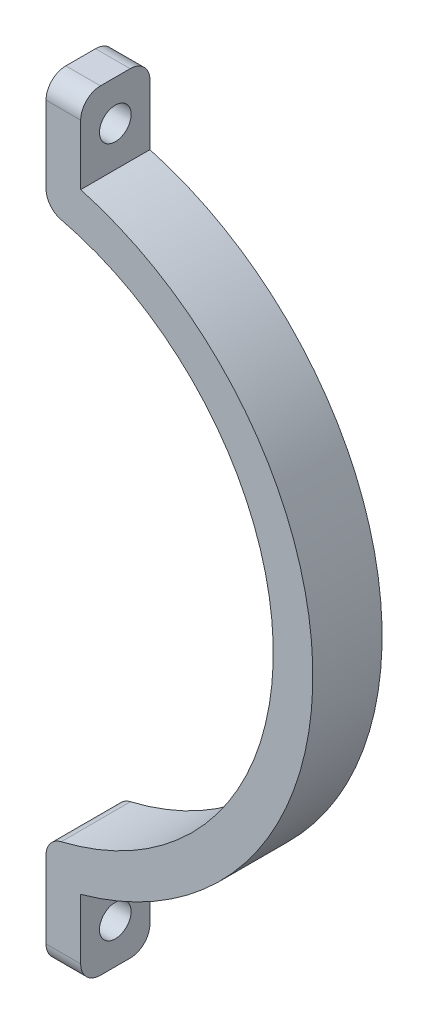
from build123d import *

# Parameters (mm, degrees)
EXTRUDE_1_DEPTH      = 3
SKETCH_7_R           = 2.2499999999999996
SKETCH_7_R_2         = 2.249999999999999
CUT_EXTRUDE_2_DEPTH  = 143.9554309486725
SKETCH_8_R           = 8
CUT_EXTRUDE_3_DEPTH  = 143.9554309486725
CUT_EXTRUDE_4_DEPTH  = 3
CUT_EXTRUDE_5_DEPTH  = 3
CUT_EXTRUDE_8_DEPTH  = 3
SKETCH_12_R          = 1.6999999999999977
SKETCH_12_R_2        = 1.6999999999999975
SKETCH_12_R_3        = 1.7000000000000015
SKETCH_12_R_4        = 1.7000000000000024
CUT_EXTRUDE_9_DEPTH  = 3
SKETCH_13_R          = 1.6999999999999977
SKETCH_13_R_2        = 1.7000000000000015
SKETCH_13_R_3        = 1.6999999999999973
CUT_EXTRUDE_11_DEPTH = 3
CUT_EXTRUDE_12_DEPTH = 143.9554309486725
FILLET_1_R           = 2
FILLET_2_R           = 2
CUT_EXTRUDE_13_DEPTH = 143.9554309486725
CUT_EXTRUDE_14_DEPTH = 143.9554309486725
CUT_EXTRUDE_15_DEPTH = 143.9554309486725
CUT_EXTRUDE_16_DEPTH = 143.9554309486725
EXTRUDE_2_DEPTH      = 4
SKETCH_20_W          = 4
SKETCH_20_H          = 23
EXTRUDE_3_DEPTH      = 5
EXTRUDE_4_DEPTH      = 7
EXTRUDE_5_DEPTH      = 9
CUT_EXTRUDE_17_DEPTH = 5
EXTRUDE_6_DEPTH      = 5
EXTRUDE_7_DEPTH      = 7
SKETCH_26_R          = 1.6000000000000008
SKETCH_26_R_2        = 1.5999999999999974
SKETCH_26_R_3        = 1.5999999999999908
SKETCH_26_R_4        = 1.5999999999999979
CUT_EXTRUDE_18_DEPTH = 27.000000000000004
FILLET_3_R           = 2
FILLET_4_R           = 2
FILLET_5_R           = 2
FILLET_6_R           = 2
FILLET_7_R           = 2
FILLET_8_R           = 2
FILLET_9_R           = 2
FILLET_10_R          = 2
FILLET_11_R          = 2
FILLET_12_R          = 2
SKETCH_29_W          = 19.839717489785563
SKETCH_29_H          = 23.000000000000004
EXTRUDE_8_DEPTH      = 4
CUT_EXTRUDE_21_DEPTH = 10
FILLET_13_R          = 3
EXTRUDE_START        = -24
EXTRUDE_9_DEPTH      = 24
CUT_EXTRUDE_22_DEPTH = 10
FILLET_14_R          = 3
EXTRUDE_10_DEPTH     = 4
SKETCH_42_W          = 21.709593228890974
SKETCH_42_H          = 23.000000000000007
EXTRUDE_11_DEPTH     = 4
CUT_EXTRUDE_23_DEPTH = 10
FILLET_15_R          = 3
SKETCH_44_W          = 80.94590288648357
SKETCH_44_H          = 89.37149872597075
CUT_EXTRUDE_24_DEPTH = 30
SKETCH_45_W          = 13.184397867353104
SKETCH_45_H          = 88.75583781718359
CUT_EXTRUDE_25_DEPTH = 40


# Read off the part's stored shape, not the designer's step: 切除-拉伸19
with BuildPart() as part:
    # 草图1 → 凸台-拉伸1 (new body)
    # profile 1 of 14: a face of its own
    with BuildSketch(Plane.XY):
        with BuildLine():
            Line((59.99999999999994, 106.6032960019551), (35.88916363361177, 121.66451915871228))
            Line((35.88916363361177, 121.66451915871228), (-35.88916363361177, 121.66451915871227))
            Line((-35.88916363361177, 121.66451915871227), (-59.99999999999998, 106.60329600195507))
            Line((-59.99999999999998, 106.60329600195509), (-59.99999999999998, 94.80189226525114))
            Line((-59.999999999999964, 94.80189226525113), (-44.999999999999964, 94.80189226525111))
            ThreePointArc((-44.999999999999964, 94.80189226525111), (-43.7625631329235, 94.28932913232757), (-43.24999999999996, 93.05189226525111))
            Line((-43.24999999999996, 93.05189226525111), (-37.74999999999997, 93.05189226525111))
            ThreePointArc((-37.74999999999997, 93.05189226525111), (-37.237436867076426, 94.28932913232757), (-35.999999999999964, 94.80189226525111))
            Line((-35.999999999999964, 94.80189226525111), (-20.999999999999964, 94.80189226525111))
            ThreePointArc((-20.999999999999964, 94.80189226525111), (-19.762563132923507, 94.28932913232757), (-19.249999999999964, 93.05189226525111))
            Line((-19.249999999999957, 93.05189226525111), (19.249999999999986, 93.05189226525111))
            ThreePointArc((19.24999999999998, 93.05189226525111), (19.76256313292352, 94.28932913232757), (20.99999999999998, 94.80189226525111))
            Line((20.99999999999998, 94.80189226525111), (35.99999999999998, 94.80189226525111))
            ThreePointArc((35.99999999999998, 94.80189226525111), (37.23743686707644, 94.28932913232757), (37.749999999999986, 93.05189226525111))
            Line((37.749999999999986, 93.05189226525111), (43.249999999999986, 93.05189226525111))
            ThreePointArc((43.24999999999997, 93.05189226525111), (43.76256313292352, 94.28932913232757), (44.99999999999998, 94.80189226525111))
            Line((44.99999999999998, 94.80189226525111), (59.99999999999997, 94.80189226525113))
            Line((59.99999999999997, 94.80189226525113), (59.99999999999997, 106.6032960019551))
        make_face()
    # profile 2 of 14: a face of its own
    with BuildSketch(Plane.XY):
        with BuildLine():
            Line((66.90169409482209, 102.29204137178812), (59.99999999999994, 106.6032960019551))
            Line((59.99999999999997, 106.6032960019551), (59.99999999999997, 94.80189226525113))
            ThreePointArc((59.99999999999997, 94.80189226525113), (61.23743686707643, 94.28932913232758), (61.74999999999998, 93.05189226525113))
            Line((61.749999999999986, 93.05189226525111), (66.9016940948221, 93.05189226525111))
            Line((66.90169409482209, 93.05189226525111), (66.90169409482209, 102.29204137178812))
        make_face()
    # profile 3 of 14: a face of its own
    with BuildSketch(Plane.XY):
        with BuildLine():
            Line((-59.99999999999998, 94.80189226525114), (-59.99999999999998, 106.60329600195509))
            Line((-59.99999999999998, 106.60329600195507), (-66.90169409482209, 102.2920413717881))
            Line((-66.90169409482209, 102.2920413717881), (-66.90169409482209, 93.05189226525111))
            Line((-66.90169409482209, 93.05189226525111), (-61.74999999999997, 93.05189226525111))
            ThreePointArc((-61.74999999999997, 93.05189226525113), (-61.237436867076426, 94.28932913232758), (-59.999999999999964, 94.80189226525113))
        make_face()
    # profile 4 of 14: a face of its own
    with BuildSketch(Plane.XY):
        with BuildLine():
            Line((66.90169409482212, 63.05189226525111), (66.90169409482209, 93.05189226525111))
            Line((66.9016940948221, 93.05189226525111), (61.749999999999986, 93.05189226525111))
            ThreePointArc((61.74999999999998, 93.05189226525113), (61.23743686707643, 91.81445539817466), (59.99999999999997, 91.30189226525113))
            Line((59.99999999999998, 91.30189226525113), (59.99999999999998, 64.80189226525113))
            ThreePointArc((59.99999999999998, 64.8018922652511), (61.23743686707643, 64.28932913232755), (61.74999999999997, 63.0518922652511))
            Line((61.749999999999986, 63.05189226525111), (66.9016940948221, 63.05189226525111))
        make_face()
    # profile 5 of 14: a face of its own
    with BuildSketch(Plane.XY):
        with BuildLine():
            Line((-61.74999999999997, 93.05189226525111), (-66.90169409482209, 93.05189226525111))
            Line((-66.90169409482209, 93.05189226525111), (-66.90169409482209, 63.05189226525111))
            Line((-66.90169409482209, 63.05189226525111), (-61.74999999999997, 63.05189226525111))
            ThreePointArc((-61.74999999999997, 63.0518922652511), (-61.237436867076426, 64.28932913232755), (-59.999999999999964, 64.8018922652511))
            Line((-59.99999999999999, 64.8018922652511), (-59.99999999999998, 91.30189226525114))
            ThreePointArc((-59.999999999999964, 91.30189226525113), (-61.237436867076426, 91.81445539817467), (-61.74999999999997, 93.05189226525113))
        make_face()
    # profile 6 of 14: a face of its own
    with BuildSketch(Plane.XY):
        with BuildLine():
            Line((66.90169409482212, 52.870133869290264), (66.90169409482212, 63.05189226525111))
            Line((66.9016940948221, 63.05189226525111), (61.749999999999986, 63.05189226525111))
            ThreePointArc((61.74999999999997, 63.0518922652511), (61.23743686707643, 61.814455398174644), (59.99999999999998, 61.3018922652511))
            Line((59.99999999999998, 61.301892265251126), (59.999999999999986, 31.261343000504525))
            Line((59.999999999999986, 31.261343000504528), (75.00000000000001, 31.26134300050453))
            Line((75.00000000000001, 31.26134300050453), (75.00000000000001, 40.93388979542704))
            ThreePointArc((75.00000000000001, 40.93388979542704), (69.11735192662594, 45.6580523194762), (66.90169409482212, 52.870133869290264))
        make_face()
    # profile 7 of 14: a face of its own
    with BuildSketch(Plane.XY):
        with BuildLine():
            Line((59.99999999999998, 64.80189226525113), (59.99999999999998, 91.30189226525113))
            Line((59.99999999999997, 91.30189226525113), (44.99999999999998, 91.30189226525111))
            ThreePointArc((44.99999999999998, 91.30189226525111), (43.76256313292352, 91.81445539817466), (43.24999999999997, 93.05189226525111))
            Line((43.249999999999986, 93.05189226525111), (37.749999999999986, 93.05189226525111))
            ThreePointArc((37.749999999999986, 93.05189226525111), (37.23743686707644, 91.81445539817466), (35.99999999999998, 91.30189226525111))
            Line((35.99999999999998, 91.30189226525111), (20.99999999999998, 91.30189226525111))
            ThreePointArc((20.99999999999998, 91.30189226525111), (19.76256313292352, 91.81445539817466), (19.24999999999998, 93.05189226525111))
            Line((19.249999999999986, 93.05189226525111), (-19.249999999999957, 93.05189226525111))
            ThreePointArc((-19.249999999999964, 93.05189226525111), (-19.762563132923507, 91.81445539817466), (-20.999999999999964, 91.30189226525111))
            Line((-20.999999999999964, 91.30189226525111), (-35.999999999999964, 91.30189226525111))
            ThreePointArc((-35.999999999999964, 91.30189226525111), (-37.237436867076426, 91.81445539817466), (-37.74999999999997, 93.05189226525111))
            Line((-37.74999999999997, 93.05189226525111), (-43.24999999999996, 93.05189226525111))
            ThreePointArc((-43.24999999999996, 93.05189226525111), (-43.7625631329235, 91.81445539817466), (-44.999999999999964, 91.30189226525111))
            Line((-44.999999999999964, 91.30189226525111), (-59.999999999999964, 91.30189226525113))
            Line((-59.99999999999998, 91.30189226525114), (-59.99999999999999, 64.8018922652511))
            Line((-59.999999999999964, 64.8018922652511), (-44.999999999999964, 64.80189226525111))
            ThreePointArc((-44.999999999999964, 64.80189226525111), (-43.7625631329235, 64.28932913232757), (-43.24999999999996, 63.05189226525111))
            Line((-43.24999999999996, 63.05189226525111), (-37.74999999999997, 63.05189226525111))
            ThreePointArc((-37.74999999999997, 63.05189226525111), (-37.237436867076426, 64.28932913232757), (-35.999999999999964, 64.80189226525111))
            Line((-35.999999999999964, 64.80189226525111), (-20.999999999999964, 64.80189226525111))
            ThreePointArc((-20.999999999999964, 64.80189226525111), (-19.762563132923507, 64.28932913232757), (-19.249999999999964, 63.05189226525111))
            Line((-19.249999999999957, 63.05189226525111), (19.24999999999997, 63.05189226525111))
            ThreePointArc((19.24999999999997, 63.05189226525111), (19.762563132923514, 64.28932913232757), (20.99999999999997, 64.80189226525111))
            Line((20.99999999999997, 64.80189226525111), (35.99999999999997, 64.80189226525111))
            ThreePointArc((35.99999999999997, 64.80189226525111), (37.23743686707643, 64.28932913232757), (37.74999999999998, 63.05189226525111))
            Line((37.749999999999986, 63.05189226525111), (43.24999999999996, 63.05189226525111))
            ThreePointArc((43.249999999999964, 63.05189226525111), (43.76256313292351, 64.28932913232757), (44.99999999999997, 64.80189226525111))
            Line((44.99999999999997, 64.80189226525111), (59.99999999999998, 64.80189226525113))
        make_face()
    # profile 8 of 14: a face of its own
    with BuildSketch(Plane.XY):
        with BuildLine():
            Line((-61.74999999999997, 63.05189226525111), (-66.90169409482209, 63.05189226525111))
            Line((-66.90169409482209, 63.05189226525111), (-66.90169409482209, 52.87013386929025))
            ThreePointArc((-66.90169409482209, 52.87013386929025), (-69.11735192662591, 45.65805231947618), (-74.99999999999999, 40.93388979542702))
            Line((-74.99999999999999, 40.93388979542702), (-74.99999999999999, 31.26134300050451))
            Line((-74.99999999999999, 31.26134300050451), (-60, 31.261343000504514))
            Line((-60, 31.26134300050451), (-59.99999999999999, 61.3018922652511))
            ThreePointArc((-59.999999999999964, 61.30189226525109), (-61.237436867076426, 61.81445539817464), (-61.74999999999997, 63.0518922652511))
        make_face()
    # profile 9 of 14: a face of its own
    with BuildSketch(Plane.XY):
        with BuildLine():
            Line((59.999999999999986, 31.261343000504525), (59.99999999999998, 61.301892265251126))
            Line((59.99999999999998, 61.30189226525112), (44.99999999999997, 61.30189226525111))
            ThreePointArc((44.99999999999997, 61.301892265251105), (43.76256313292351, 61.81445539817465), (43.249999999999964, 63.05189226525111))
            Line((43.24999999999996, 63.05189226525111), (37.749999999999986, 63.05189226525111))
            ThreePointArc((37.74999999999998, 63.05189226525111), (37.23743686707643, 61.81445539817465), (35.99999999999997, 61.301892265251105))
            Line((35.99999999999997, 61.30189226525111), (20.99999999999997, 61.30189226525111))
            ThreePointArc((20.99999999999997, 61.30189226525111), (19.762563132923514, 61.81445539817465), (19.24999999999997, 63.05189226525111))
            Line((19.24999999999997, 63.05189226525111), (-19.249999999999957, 63.05189226525111))
            ThreePointArc((-19.249999999999964, 63.05189226525111), (-19.762563132923507, 61.81445539817465), (-20.999999999999964, 61.30189226525111))
            Line((-20.999999999999964, 61.30189226525111), (-35.999999999999964, 61.30189226525111))
            ThreePointArc((-35.999999999999964, 61.301892265251105), (-37.237436867076426, 61.81445539817465), (-37.74999999999997, 63.05189226525111))
            Line((-37.74999999999997, 63.05189226525111), (-43.24999999999996, 63.05189226525111))
            ThreePointArc((-43.24999999999996, 63.05189226525111), (-43.7625631329235, 61.81445539817465), (-44.999999999999964, 61.301892265251105))
            Line((-44.999999999999964, 61.30189226525111), (-59.999999999999964, 61.3018922652511))
            Line((-59.99999999999999, 61.3018922652511), (-60, 31.26134300050451))
            Line((-60, 31.261343000504514), (59.999999999999986, 31.261343000504528))
        make_face()
    # profile 10 of 14: a face of its own
    with BuildSketch(Plane.XY):
        with BuildLine():
            Line((60.00000000000001, -58.31286428889716), (59.999999999999986, 23.940028390779446))
            Line((59.999999999999986, 23.940028390779425), (-60, 23.94002839077941))
            Line((-60, 23.940028390779403), (-60.00000000000003, -58.31286428889722))
            Line((-60.00000000000003, -58.31286428889722), (-44.99999999999997, -58.31286428889719))
            ThreePointArc((-44.99999999999997, -58.312864288897195), (-43.24999999999989, -60.06286428889721), (-44.99999999999997, -61.812864288897224))
            Line((-44.99999999999997, -61.812864288897224), (-60.00000000000006, -61.81286428889722))
            Line((-60.00000000000006, -61.81286428889722), (-60.00000000000002, -88.31286428889688))
            Line((-60.00000000000002, -88.31286428889688), (-44.99999999999999, -88.31286428889679))
            ThreePointArc((-44.99999999999999, -88.31286428889678), (-43.25000000000038, -90.06286428889678), (-44.99999999999999, -91.81286428889678))
            Line((-44.99999999999999, -91.81286428889679), (-60.000000000000014, -91.81286428889689))
            Line((-60.000000000000014, -91.81286428889689), (-60, -111.8499672560037))
            Line((-60, -111.8499672560037), (-38.845469114440476, -105.59057673322376))
            ThreePointArc((-38.845469114440476, -105.59057673322376), (-36.03778449152867, -104.97521010805474), (-33.170885730154765, -104.76866588242706))
            Line((-33.170885730154765, -104.76866588242706), (33.17088573015482, -104.76866588242706))
            ThreePointArc((33.17088573015482, -104.76866588242706), (36.03778449152872, -104.97521010805474), (38.84546911444053, -105.59057673322376))
            Line((38.84546911444053, -105.59057673322376), (60.000000000000014, -111.84996725600368))
            Line((60.000000000000014, -111.84996725600368), (60.00000000000001, -91.81286428889712))
            Line((60.00000000000007, -91.81286428889712), (45.00000000000003, -91.81286428889699))
            ThreePointArc((45.00000000000003, -91.81286428889699), (43.762563132922956, -91.30030115597347), (43.24999999999931, -90.06286428889646))
            ThreePointArc((43.24999999999931, -90.06286428889646), (43.76256313292323, -88.82542742181997), (45.00000000000002, -88.31286428889673))
            Line((45.00000000000002, -88.31286428889673), (60.00000000000006, -88.31286428889713))
            Line((60.00000000000001, -88.31286428889713), (60.00000000000001, -61.812864288897174))
            Line((60.00000000000001, -61.81286428889717), (45.000000000000036, -61.81286428889717))
            ThreePointArc((45.000000000000036, -61.812864288897174), (43.762563132923574, -61.300301155973635), (43.250000000000014, -60.062864288897174))
            ThreePointArc((43.250000000000014, -60.062864288897174), (43.76256313292355, -58.82542742182069), (45.000000000000036, -58.31286428889713))
            Line((45.000000000000036, -58.31286428889713), (60.00000000000001, -58.31286428889716))
        make_face()
        with BuildLine():
            ThreePointArc((-20.999999999999964, -88.31286428889648), (-19.76256313292351, -88.82542742182001), (-19.249999999999964, -90.06286428889646))
            ThreePointArc((-19.249999999999964, -90.06286428889646), (-19.7625631329235, -91.30030115597293), (-20.999999999999964, -91.81286428889648))
            Line((-20.999999999999964, -91.81286428889648), (-35.999999999999964, -91.81286428889648))
            ThreePointArc((-35.999999999999964, -91.81286428889648), (-37.74999999999999, -90.06286428889648), (-35.999999999999964, -88.31286428889648))
            Line((-35.999999999999964, -88.31286428889648), (-20.999999999999964, -88.31286428889648))
        make_face(mode=Mode.SUBTRACT)
        with BuildLine():
            ThreePointArc((-20.999999999999964, -58.31286428889723), (-19.762563132923184, -58.82542742182099), (-19.249999999999854, -60.06286428889795))
            ThreePointArc((-19.249999999999854, -60.06286428889795), (-19.762563132923688, -61.30030115597399), (-20.999999999999964, -61.812864288897245))
            Line((-20.999999999999964, -61.812864288897245), (-35.99999999999992, -61.81286428889731))
            ThreePointArc((-35.99999999999992, -61.81286428889731), (-37.75000000000054, -60.06286428889735), (-36.000000000000014, -58.31286428889731))
            Line((-36.000000000000014, -58.3128642888973), (-20.999999999999964, -58.31286428889723))
        make_face(mode=Mode.SUBTRACT)
        with BuildLine():
            ThreePointArc((36.00000000000002, -88.31286428889648), (37.23743686707648, -88.82542742182002), (37.75000000000002, -90.06286428889649))
            ThreePointArc((37.75000000000002, -90.06286428889649), (37.237436867076475, -91.30030115597295), (36.00000000000002, -91.81286428889648))
            Line((36.00000000000002, -91.81286428889648), (21.000000000000018, -91.81286428889648))
            ThreePointArc((21.000000000000018, -91.81286428889648), (19.762563132923546, -91.30030115597292), (19.250000000000018, -90.06286428889644))
            ThreePointArc((19.250000000000018, -90.06286428889644), (19.762563132923574, -88.82542742182001), (21.000000000000018, -88.31286428889648))
            Line((21.000000000000018, -88.31286428889648), (36.00000000000002, -88.31286428889648))
        make_face(mode=Mode.SUBTRACT)
        with BuildLine():
            ThreePointArc((36.00000000000001, -58.31286428889745), (37.2374368670764, -58.825427421820926), (37.75000000000002, -60.06286428889725))
            ThreePointArc((37.75000000000002, -60.06286428889725), (37.23743686707655, -61.30030115597386), (36.00000000000001, -61.812864288897494))
            Line((36.00000000000001, -61.812864288897494), (21.000000000000004, -61.812864288897494))
            ThreePointArc((21.000000000000004, -61.812864288897494), (19.762563132923542, -61.30030115597395), (19.249999999999993, -60.06286428889749))
            ThreePointArc((19.249999999999993, -60.06286428889749), (19.762563132923532, -58.82542742182101), (21.000000000000004, -58.31286428889745))
            Line((21.000000000000004, -58.31286428889745), (36.00000000000001, -58.31286428889745))
        make_face(mode=Mode.SUBTRACT)
    # profile 11 of 14: a face of its own
    with BuildSketch(Plane.XY):
        with BuildLine():
            Line((75.00000000000001, 23.94002839077943), (59.999999999999986, 23.940028390779425))
            Line((59.999999999999986, 23.940028390779446), (60.00000000000001, -58.31286428889716))
            ThreePointArc((60.00000000000001, -58.31286428889715), (61.237436867076404, -58.82542742182061), (61.750000000000036, -60.06286428889695))
            Line((61.750000000000036, -60.06286428889696), (67.40272133408746, -60.06286428889689))
            add(Edge.make_bspline(
                [(75.00000000000001, 10.562559835431854), (72.69587825706628, 1.9073142333592985), (70.33958253529204, -13.372796252870137), (67.81820670408499, -36.93903295106657), (67.20886038798805, -51.77269444017321), (67.40272133408746, -60.06286428889608)],
                knots=[0, 0, 0, 0, 0.23524667827066936, 0.40629418957963404, 0.6241081814572702, 0.6241081814572702, 0.6241081814572702, 0.6241081814572702], degree=3))
            Line((75.00000000000001, 10.562559835431854), (75.00000000000001, 23.94002839077943))
        make_face()
    # profile 12 of 14: a face of its own
    with BuildSketch(Plane.XY):
        with BuildLine():
            Line((-60.00000000000003, -58.31286428889722), (-60, 23.940028390779403))
            Line((-60, 23.94002839077941), (-74.99999999999999, 23.94002839077941))
            Line((-74.99999999999999, 23.94002839077941), (-74.99999999999999, 10.562559835431834))
            add(Edge.make_bspline(
                [(-74.99999999999999, 10.562559835431834), (-72.69587825706623, 1.9073142333592807), (-70.33958253529205, -13.372796252870154), (-67.81820670408486, -36.93903295106704), (-67.20886038798794, -51.77269444017414), (-67.40272133408743, -60.06286428889747)],
                knots=[0, 0, 0, 0, 0.23524667827066936, 0.40629418957963404, 0.6241081814572824, 0.6241081814572824, 0.6241081814572824, 0.6241081814572824], degree=3))
            add(Edge.make_bspline(
                [(-67.40272133408743, -60.06286428889747), (-67.56032587245761, -66.80258375435272), (-68.323504015194, -76.84367009307445), (-70.1541319554568, -86.77853007567795), (-70.53371285765535, -90.06286428889649)],
                knots=[0.6241081814572824, 0.6241081814572824, 0.6241081814572824, 0.6241081814572824, 0.8011860010549554, 0.8884086519703641, 0.8884086519703641, 0.8884086519703641, 0.8884086519703641], degree=3))
            add(Edge.make_bspline(
                [(-70.53371285765536, -90.06286428889649), (-71.01934295623744, -94.26479209533699), (-71.13742293500087, -98.47604820555091), (-70.17426240042177, -102.73279405880234)],
                knots=[0.8884086519703641, 0.8884086519703641, 0.8884086519703641, 0.8884086519703641, 1, 1, 1, 1], degree=3))
            Line((-70.17426240042177, -102.73279405880234), (-66.46081763531664, -113.76165137202992))
            Line((-66.46081763531664, -113.76165137202992), (-60, -111.8499672560037))
            Line((-60, -111.8499672560037), (-60.000000000000014, -91.81286428889689))
            ThreePointArc((-60.000000000000014, -91.81286428889688), (-61.75000000000035, -90.06286428889688), (-60.00000000000002, -88.31286428889688))
            Line((-60.00000000000002, -88.31286428889688), (-60.00000000000006, -61.81286428889722))
            ThreePointArc((-60.00000000000006, -61.81286428889722), (-61.749999999999986, -60.0628642888972), (-60.00000000000003, -58.31286428889722))
        make_face()
    # profile 13 of 14: a face of its own
    with BuildSketch(Plane.XY):
        with BuildLine():
            Line((67.40272133408746, -60.06286428889689), (61.750000000000036, -60.06286428889696))
            ThreePointArc((61.750000000000036, -60.06286428889695), (61.23743686707656, -61.30030115597356), (60.00000000000001, -61.81286428889717))
            Line((60.00000000000001, -61.812864288897174), (60.00000000000001, -88.31286428889713))
            ThreePointArc((60.00000000000006, -88.31286428889713), (61.23743686707617, -88.8254274218205), (61.749999999999865, -90.06286428889649))
            Line((61.74999999999987, -90.06286428889648), (70.53371285765562, -90.06286428889648))
            add(Edge.make_bspline(
                [(67.40272133408746, -60.06286428889608), (67.56032587245758, -66.80258375435179), (68.32350401519398, -76.8436700930743), (70.15413195545696, -86.77853007567856), (70.5337128576555, -90.0628642888974)],
                knots=[0.6241081814572702, 0.6241081814572702, 0.6241081814572702, 0.6241081814572702, 0.8011860010549554, 0.8884086519703727, 0.8884086519703727, 0.8884086519703727, 0.8884086519703727], degree=3))
        make_face()
    # profile 14 of 14: a face of its own
    with BuildSketch(Plane.XY):
        with BuildLine():
            add(Edge.make_bspline(
                [(70.5337128576555, -90.06286428889742), (71.0193429562375, -94.26479209533758), (71.13742293500084, -98.4760482055512), (70.17426240042182, -102.73279405880233)],
                knots=[0.8884086519703727, 0.8884086519703727, 0.8884086519703727, 0.8884086519703727, 1, 1, 1, 1], degree=3))
            Line((70.53371285765562, -90.06286428889648), (61.74999999999987, -90.06286428889648))
            ThreePointArc((61.749999999999865, -90.06286428889649), (61.23743686707662, -91.30030115597327), (60.00000000000007, -91.8128642888971))
            Line((60.00000000000001, -91.81286428889712), (60.000000000000014, -111.84996725600368))
            Line((60.000000000000014, -111.84996725600368), (66.46081763531669, -113.76165137202992))
            Line((66.46081763531669, -113.76165137202992), (70.17426240042177, -102.73279405880234))
        make_face()
    extrude(amount=EXTRUDE_1_DEPTH)

    # 草图7 → 切除-拉伸2 (cut, through all)
    with BuildSketch(Plane(origin=(0, 0, 0), x_dir=(-1, 0, 0), z_dir=(0, 0, -1))):
        with Locations((-20.99999999999999, 41.26134300050451)):
            Circle(SKETCH_7_R)
        with Locations((21.00000000000001, 41.26134300050451)):
            Circle(SKETCH_7_R)
        with Locations((-20.999999999999986, 13.940028390779407)):
            Circle(SKETCH_7_R_2)
        with Locations((21.000000000000014, 13.94002839077941)):
            Circle(SKETCH_7_R_2)
    extrude(amount=-CUT_EXTRUDE_2_DEPTH, mode=Mode.SUBTRACT)

    # 草图8 → 切除-拉伸3 (cut, through all)
    with BuildSketch(Plane.XY.offset(3)):
        with BuildLine():
            Line((-12.621438714311319, -0.37855794544282684), (-33.40901034462534, 20.409013684871184))
            ThreePointArc((-33.40901034462534, 20.409013684871184), (-36.59099943422989, 20.40901364306184), (-36.59099930880186, 17.227024553457287))
            Line((-36.59099930880186, 17.227024553457287), (-15.803426585945267, -3.560545984314082))
            ThreePointArc((-15.803426585945267, -3.5605459843140808), (-12.621438672501986, -3.560545858886111), (-12.621438714311319, -0.37855794544282695))
        make_face()
        with BuildLine():
            Line((33.41046205612755, 20.410458797881883), (12.572988319328147, -0.4270108235691197))
            ThreePointArc((12.572988319327871, -0.42701082356886033), (12.644570440569202, -3.5847649934052432), (15.803045701641096, -3.560902420256042))
            Line((15.803045701641098, -3.560902420256043), (34.99999998205021, 15.636052773684106))
            Line((34.99999998205021, 15.636052773684106), (36.5880869521281, 17.22413981933475))
            ThreePointArc((36.5880869521281, 17.22413981933475), (36.59243399340139, 20.406111756608592), (33.41046205612755, 20.410458797881883))
        make_face()
        with BuildLine():
            Line((-15.803784811617428, -28.803778350173733), (-36.59100218625151, -49.590991619384916))
            ThreePointArc((-36.59100218625151, -49.590991619384916), (-36.591002402986206, -52.772972232183115), (-33.409021790188, -52.77297225395409))
            Line((-33.409021790188, -52.77297225395409), (-12.573723915912868, -31.937673388183576))
            ThreePointArc((-12.573723915912868, -31.937673388183576), (-12.645306280144124, -28.779915954044938), (-15.803784811617428, -28.803778350173733))
        make_face()
        with BuildLine():
            Line((36.59099266643557, -49.59098932618961), (15.803414626556833, -28.803411286310908))
            ThreePointArc((15.803414626556835, -28.803411286310908), (12.654338963515047, -28.7697743019421), (12.553443359950268, -31.917412949477868))
            Line((12.553443359950265, -31.91741294947787), (33.40900738128343, -52.77297477857893))
            ThreePointArc((33.40900738128343, -52.77297477857893), (36.59099270824486, -52.772974653151046), (36.59099266643557, -49.59098932618961))
        make_face()
        with Locations((-0.00036878160574946, -16.182341353605377)):
            Circle(SKETCH_8_R)
    extrude(amount=-CUT_EXTRUDE_3_DEPTH, mode=Mode.SUBTRACT)

    # 草图9 → 切除-拉伸4 (cut)
    with BuildSketch(Plane.XY.offset(3)):
        with BuildLine():
            Line((55.000000000000036, -100.49704609007622), (20.000000000000032, -100.49704609007622))
            ThreePointArc((20.000000000000032, -100.49704609007622), (18.250000000000032, -98.74704609007622), (20.000000000000032, -96.99704609007622))
            Line((20.000000000000032, -96.99704609007622), (55.000000000000036, -96.99704609007622))
            ThreePointArc((55.000000000000036, -96.99704609007622), (56.750000000000036, -98.74704609007622), (55.000000000000036, -100.49704609007622))
        make_face()
        with BuildLine():
            Line((-54.99999999999998, -96.99704609007622), (-19.999999999999975, -96.99704609007622))
            ThreePointArc((-19.999999999999975, -96.99704609007622), (-18.249999999999975, -98.74704609007622), (-19.999999999999975, -100.49704609007622))
            Line((-19.999999999999975, -100.49704609007622), (-54.99999999999998, -100.49704609007622))
            ThreePointArc((-54.99999999999998, -100.49704609007622), (-56.74999999999998, -98.74704609007622), (-54.99999999999998, -96.99704609007622))
        make_face()
    extrude(amount=-CUT_EXTRUDE_4_DEPTH, mode=Mode.SUBTRACT)

    # 草图10 → 切除-拉伸5 (cut)
    with BuildSketch(Plane.XY.offset(3)):
        with BuildLine():
            Line((12.500000000000218, -80.06286428889683), (-12.499999999999915, -80.06286428889685))
            ThreePointArc((-12.499999999999915, -80.06286428889685), (-17.499999999999964, -75.06286428889683), (-12.499999999999966, -70.0628642888968))
            Line((-12.499999999999966, -70.0628642888968), (12.500000000000068, -70.0628642888968))
            ThreePointArc((12.500000000000068, -70.0628642888968), (17.500000000000064, -75.06286428889673), (12.500000000000218, -80.06286428889683))
        make_face()
    extrude(amount=-CUT_EXTRUDE_5_DEPTH, mode=Mode.SUBTRACT)

    # 草图11 → 切除-拉伸8 (cut)
    with BuildSketch(Plane.XY.offset(3)):
        with BuildLine():
            Line((15.000000000000004, 73.05189226525113), (-14.999999999999998, 73.05189226525113))
            ThreePointArc((-14.999999999999998, 73.05189226525113), (-19.999999999999996, 78.05189226525111), (-14.999999999999996, 83.05189226525111))
            Line((-14.999999999999996, 83.05189226525111), (15.000000000000004, 83.05189226525111))
            ThreePointArc((15.000000000000004, 83.05189226525111), (19.99999999999999, 78.05189226525111), (15.000000000000004, 73.05189226525113))
        make_face()
    extrude(amount=-CUT_EXTRUDE_8_DEPTH, mode=Mode.SUBTRACT)

    # 草图12 → 切除-拉伸9 (cut)
    with BuildSketch(Plane.XY.offset(3)):
        with Locations((0, 114.37178643513211)):
            Circle(SKETCH_12_R)
        with Locations((0, 98.3717864351321)):
            Circle(SKETCH_12_R_2)
        with Locations((8.000000000000002, 106.37178643513211)):
            Circle(SKETCH_12_R_3)
        with Locations((-8.000000000000002, 106.37178643513211)):
            Circle(SKETCH_12_R_4)
    extrude(amount=-CUT_EXTRUDE_9_DEPTH, mode=Mode.SUBTRACT)

    # 草图13 → 切除-拉伸11 (cut)
    with BuildSketch(Plane.XY.offset(3)):
        with Locations((8.934e-14, -84.41576508566195)):
            Circle(SKETCH_13_R)
        with Locations((8.000000000000092, -92.41576508566195)):
            Circle(SKETCH_13_R_2)
        with Locations((8.934e-14, -100.41576508566196)):
            Circle(SKETCH_13_R_3)
        with Locations((-7.999999999999912, -92.41576508566195)):
            Circle(SKETCH_13_R_3)
    extrude(amount=-CUT_EXTRUDE_11_DEPTH, mode=Mode.SUBTRACT)

    # 草图14 → 切除-拉伸12 (cut, through all)
    with BuildSketch(Plane.XY.offset(3)):
        with BuildLine():
            Line((-55.47550156736941, 8.919687235970343), (-55.475501567369406, -46.08031276402966))
            ThreePointArc((-55.475501567369406, -46.08031276402966), (-57.225501567369406, -47.83031276402966), (-58.975501567369406, -46.08031276402966))
            Line((-58.975501567369406, -46.08031276402966), (-58.97550156736941, 8.919687235970343))
            ThreePointArc((-58.97550156736941, 8.919687235970343), (-57.22550156736941, 10.669687235970343), (-55.47550156736941, 8.919687235970343))
        make_face()
        with BuildLine():
            Line((58.97550156736944, 8.919687235970358), (58.97550156736945, -46.08031276402966))
            ThreePointArc((58.97550156736945, -46.08031276402966), (57.22550156736945, -47.83031276402966), (55.47550156736945, -46.08031276402966))
            Line((55.47550156736945, -46.08031276402966), (55.47550156736944, 8.919687235970354))
            ThreePointArc((55.47550156736944, 8.919687235970354), (57.22550156736944, 10.669687235970358), (58.97550156736944, 8.919687235970358))
        make_face()
    extrude(amount=-CUT_EXTRUDE_12_DEPTH, mode=Mode.SUBTRACT)

    # 圆角1
    fillet_1_edges = [part.edges().sort_by_distance(p)[0] for p in [
        (75.00000000000001, 31.26134300050453, 1.5),
        (-74.99999999999999, 31.26134300050451, 1.5),
    ]]
    fillet(fillet_1_edges, radius=FILLET_1_R)

    # 圆角2
    fillet_2_edges = [part.edges().sort_by_distance(p)[0] for p in [
        (-74.99999999999999, 23.94002839077941, 1.5),
        (75.00000000000001, 23.94002839077943, 1.5),
    ]]
    fillet(fillet_2_edges, radius=FILLET_2_R)

    # 草图15 → 切除-拉伸13 (cut, through all)
    with BuildSketch(Plane(origin=(0, 0, 0), x_dir=(-1, 0, 0), z_dir=(0, 0, -1))):
        with BuildLine():
            Line((-61.18421640135317, 102.40350127585891), (-34.77476286241414, 118.90059275595658))
            ThreePointArc((-34.77476286241414, 118.90059275595658), (-32.707881589653226, 118.42309741115184), (-33.18537693445796, 116.35621613839092))
            Line((-33.18537693445796, 116.35621613839092), (-59.59483047339698, 99.85912465829324))
            ThreePointArc((-59.59483047339698, 99.85912465829324), (-61.66171174615792, 100.33662000309798), (-61.18421640135317, 102.40350127585891))
        make_face()
        with BuildLine():
            Line((59.59483047339698, 99.85912465829323), (33.18537693445796, 116.35621613839092))
            ThreePointArc((33.18537693445796, 116.35621613839092), (32.70788158965324, 118.42309741115183), (34.77476286241414, 118.90059275595657))
            Line((34.77476286241414, 118.90059275595657), (61.18421640135317, 102.4035012758589))
            ThreePointArc((61.18421640135317, 102.4035012758589), (61.66171174615792, 100.33662000309796), (59.59483047339698, 99.85912465829323))
        make_face()
    extrude(amount=-CUT_EXTRUDE_13_DEPTH, mode=Mode.SUBTRACT)

    # 草图16 → 切除-拉伸14 (cut, through all)
    with BuildSketch(Plane(origin=(0, 0, 0), x_dir=(-1, 0, 0), z_dir=(0, 0, -1))):
        with BuildLine():
            Line((-61.516979466690685, 42.7613430005045), (-32.056291893000356, 42.76134300050451))
            ThreePointArc((-32.056291893000356, 42.76134300050451), (-30.556291893000356, 41.26134300050451), (-32.056291893000356, 39.76134300050451))
            Line((-32.056291893000356, 39.76134300050451), (-61.516979466690685, 39.76134300050452))
            ThreePointArc((-61.516979466690685, 39.76134300050452), (-63.01697946669068, 41.26134300050451), (-61.516979466690685, 42.7613430005045))
        make_face()
        with BuildLine():
            Line((61.51697946669066, 39.761343000504546), (32.05629189300033, 39.76134300050457))
            ThreePointArc((32.05629189300033, 39.76134300050457), (30.556291893000328, 41.26134300050457), (32.05629189300033, 42.76134300050457))
            Line((32.05629189300033, 42.76134300050457), (61.51697946669066, 42.76134300050453))
            ThreePointArc((61.51697946669066, 42.76134300050453), (63.01697946669065, 41.26134300050454), (61.51697946669066, 39.761343000504546))
        make_face()
    extrude(amount=-CUT_EXTRUDE_14_DEPTH, mode=Mode.SUBTRACT)

    # 草图17 → 切除-拉伸15 (cut, through all)
    with BuildSketch(Plane(origin=(0, 0, 0), x_dir=(-1, 0, 0), z_dir=(0, 0, -1))):
        Polygon((-28.645414282738436, -8.118433382478688), (-34.644957411393406, -20.117519639788632), (-34.644957411393406, -29.94655838247869), (-37.58090404882031, -29.94655838247869), (-37.58090404882031, -20.117519639788632), (-43.58044717747528, -8.118433382478688), (-40.64450054004838, -8.118433382478688), (-36.17675565700744, -17.436872709964074), (-36.04910580320627, -17.436872709964074), (-31.581360920165334, -8.118433382478688), align=None)
    extrude(amount=-CUT_EXTRUDE_15_DEPTH, mode=Mode.SUBTRACT)

    # 草图18 → 切除-拉伸16 (cut, through all)
    with BuildSketch(Plane(origin=(0, 0, 0), x_dir=(-1, 0, 0), z_dir=(0, 0, -1))):
        Polygon((46.06697123049682, -29.08752979106243), (43.13102459306992, -29.08752979106243), (43.13102459306992, -18.875541486968864), (35.85498292640325, -18.875541486968864), (35.85498292640325, -29.08752979106243), (32.91903628897636, -29.08752979106243), (32.91903628897636, -7.259404791062428), (35.85498292640325, -7.259404791062428), (35.85498292640325, -16.45019426474664), (43.13102459306992, -16.45019426474664), (43.13102459306992, -7.259404791062428), (46.06697123049682, -7.259404791062428), align=None)
    extrude(amount=-CUT_EXTRUDE_16_DEPTH, mode=Mode.SUBTRACT)


with BuildPart() as body_2:
    # 草图19 → 凸台-拉伸2 (new body)
    with BuildSketch(Plane(origin=(0, 0, -10), x_dir=(-1, 0, 0), z_dir=(0, 0, -1))):
        Polygon((-61.72550156736945, -11.08595110283974), (-75.00000000000001, -11.085951102839742), (-75.00000000000001, -34.08595110283974), (-61.72550156736942, -34.08595110283975), (-52.725501567369484, -34.08595110283974), (-52.72550156736945, -11.08595110283974), align=None)
        with BuildLine():
            ThreePointArc((-58.97550156736945, -30.08595110283975), (-57.22550156736945, -31.83595110283975), (-55.47550156736946, -30.08595110283975))
            Line((-55.47550156736946, -30.08595110283975), (-55.47550156736947, -15.085951102839749))
            ThreePointArc((-55.47550156736947, -15.085951102839749), (-57.225501567369456, -13.335951102839765), (-58.975501567369456, -15.085951102839752))
            Line((-58.975501567369456, -15.085951102839752), (-58.97550156736945, -30.08595110283975))
        make_face(mode=Mode.SUBTRACT)
    extrude(amount=EXTRUDE_2_DEPTH)

    # 草图20 → 凸台-拉伸3 (add)
    with BuildSketch(Plane(origin=(0, 0, -14), x_dir=(-1, 0, 0), z_dir=(0, 0, -1))):
        with Locations((-73.00000000000001, -22.585951102839743)):
            Rectangle(SKETCH_20_W, SKETCH_20_H)
    extrude(amount=EXTRUDE_3_DEPTH)

    # 草图21 → 凸台-拉伸4 (add)
    with BuildSketch(Plane(origin=(0, 0, -19), x_dir=(-1, 0, 0), z_dir=(0, 0, -1))):
        with BuildLine():
            Line((-102.03333333333333, -61.51352874214651), (-98.53333333333333, -61.51352874214651))
            Line((-98.53333333333333, -61.51352874214651), (-98.53333333333332, -54.27268158878431))
            ThreePointArc((-98.53333333333332, -54.27268158878431), (-71.00000000000001, -22.585951102839736), (-98.53333333333333, 9.100779383104836))
            Line((-98.53333333333333, 9.100779383104836), (-98.53333333333335, 16.34162653646702))
            Line((-98.53333333333335, 16.34162653646702), (-102.03333333333335, 16.341626536467007))
            Line((-102.03333333333335, 16.341626536467007), (-102.03333333333332, 5.397357414123636))
            ThreePointArc((-102.03333333333332, 5.397357414123636), (-75.00000000000001, -22.585951102839743), (-102.03333333333332, -50.56925961980313))
            Line((-102.03333333333332, -50.56925961980313), (-102.03333333333333, -61.51352874214651))
        make_face()
        with BuildLine():
            Line((-108.03333333333336, 16.34162653646703), (-108.03333333333337, 4.957933074152349))
            ThreePointArc((-108.03333333333337, 4.957933074152349), (-131.00000000000003, -22.58595110283974), (-108.03333333333337, -50.12983527983184))
            Line((-108.03333333333337, -50.12983527983184), (-108.03333333333335, -61.51352874214651))
            Line((-108.03333333333335, -61.51352874214651), (-111.53333333333335, -61.51352874214652))
            Line((-111.53333333333335, -61.51352874214652), (-111.53333333333335, -53.42719333174846))
            ThreePointArc((-111.53333333333335, -53.42719333174846), (-135, -22.58595110283974), (-111.53333333333336, 8.255291126068972))
            Line((-111.53333333333336, 8.255291126068972), (-111.53333333333336, 16.34162653646702))
            Line((-111.53333333333336, 16.34162653646702), (-108.03333333333336, 16.34162653646703))
        make_face()
    extrude(amount=EXTRUDE_4_DEPTH)


with BuildPart() as extrude_4_piece_1:
    # of the separate pieces the step leaves, piece 1, a body of its own (extrude_4_pieces)
    add(body_2.part.solids().sort_by_distance((75, -11.085951103, -10))[0])

    # 草图22 → 凸台-拉伸5 (add)
    with BuildSketch(Plane.XY.offset(-19)):
        with BuildLine():
            Line((75.00000000000001, -11.085951102839742), (75.00000000000001, -22.585951102839743))
            ThreePointArc((75.00000000000001, -22.585951102839743), (75.62461822158177, -16.70475458462619), (77.47060517756051, -11.085951102839743))
            Line((77.47060517756051, -11.085951102839743), (75.00000000000001, -11.085951102839742))
        make_face()
        with BuildLine():
            ThreePointArc((75.00000000000001, -22.585951102839743), (75.62461822158178, -28.467147621053293), (77.47060517756051, -34.08595110283974))
            Line((77.47060517756051, -34.08595110283974), (75.00000000000001, -34.08595110283974))
            Line((75.00000000000001, -34.08595110283974), (75.00000000000001, -22.585951102839743))
        make_face()
    extrude(amount=EXTRUDE_5_DEPTH)

    # 草图23 → 切除-拉伸17 (cut)
    with BuildSketch(Plane(origin=(0, 0, -19), x_dir=(-1, 0, 0), z_dir=(0, 0, -1))):
        with BuildLine():
            ThreePointArc((-73.13781655672177, -11.085951102839743), (-71.5389934189567, -16.737441471527816), (-71.00000000000001, -22.585951102839743))
            Line((-71.00000000000001, -22.585951102839743), (-71.00000000000001, -11.085951102839742))
            Line((-71.00000000000001, -11.085951102839742), (-73.13781655672177, -11.085951102839743))
        make_face()
        with BuildLine():
            Line((-71.00000000000001, -34.08595110283974), (-71.00000000000001, -22.585951102839743))
            ThreePointArc((-71.00000000000001, -22.585951102839743), (-71.53899341895666, -28.434460734151678), (-73.13781655672177, -34.08595110283974))
            Line((-73.13781655672177, -34.08595110283974), (-71.00000000000001, -34.08595110283974))
        make_face()
    extrude(amount=-CUT_EXTRUDE_17_DEPTH, mode=Mode.SUBTRACT)

    # 草图24 → 凸台-拉伸6 (add)
    with BuildSketch(Plane(origin=(0, 0, -26), x_dir=(-1, 0, 0), z_dir=(0, 0, -1))):
        with BuildLine():
            ThreePointArc((-73.13781655672177, -34.08595110283974), (-71, -22.58595110283973), (-73.13781655672177, -11.08595110283973))
            Line((-73.13781655672179, -11.085951102839742), (-77.47060517756051, -11.085951102839743))
            ThreePointArc((-77.47060517756051, -11.085951102839743), (-75, -22.585951102839743), (-77.47060517756051, -34.08595110283975))
            Line((-77.47060517756053, -34.08595110283974), (-73.13781655672177, -34.08595110283974))
        make_face()
    extrude(amount=EXTRUDE_6_DEPTH)

    # 草图25 → 凸台-拉伸7 (add)
    with BuildSketch(Plane(origin=(0, 0, -31), x_dir=(-1, 0, 0), z_dir=(0, 0, -1))):
        with BuildLine():
            ThreePointArc((-77.47060517756051, -11.085951102839743), (-87.39759045772182, 0.6640987137741377), (-102.03333333333332, 5.397357414123636))
            Line((-102.03333333333332, 5.397357414123636), (-102.03333333333335, 16.341626536467007))
            Line((-102.03333333333335, 16.341626536467007), (-98.53333333333335, 16.34162653646702))
            Line((-98.53333333333335, 16.34162653646702), (-98.53333333333333, 9.100779383104836))
            ThreePointArc((-98.53333333333333, 9.100779383104836), (-83.0878552286348, 2.4641285498119316), (-73.13781655672177, -11.085951102839742))
            Line((-73.13781655672177, -11.085951102839742), (-77.47060517756051, -11.085951102839743))
        make_face()
        with BuildLine():
            ThreePointArc((-77.47060517756051, -11.085951102839743), (-75, -22.585951102839743), (-77.47060517756051, -34.08595110283974))
            Line((-77.47060517756051, -34.08595110283974), (-73.13781655672177, -34.08595110283974))
            ThreePointArc((-73.13781655672177, -34.08595110283974), (-71, -22.58595110283974), (-73.13781655672177, -11.085951102839742))
            Line((-73.13781655672177, -11.085951102839742), (-77.47060517756051, -11.085951102839743))
        make_face()
        with BuildLine():
            ThreePointArc((-102.03333333333332, -50.56925961980313), (-87.39759045772183, -45.83600091945361), (-77.47060517756051, -34.08595110283974))
            Line((-77.47060517756051, -34.08595110283974), (-73.13781655672179, -34.08595110283974))
            ThreePointArc((-73.13781655672179, -34.08595110283974), (-83.0878552286348, -47.63603075549142), (-98.53333333333333, -54.272681588784316))
            Line((-98.53333333333333, -54.272681588784316), (-98.53333333333333, -61.51352874214651))
            Line((-98.53333333333333, -61.51352874214651), (-102.03333333333333, -61.51352874214651))
            Line((-102.03333333333333, -61.51352874214651), (-102.03333333333332, -50.56925961980313))
        make_face()
        with BuildLine():
            ThreePointArc((-108.03333333333337, 4.957933074152349), (-131.00000000000003, -22.58595110283974), (-108.03333333333337, -50.12983527983184))
            Line((-108.03333333333337, -50.12983527983184), (-108.03333333333335, -61.51352874214651))
            Line((-108.03333333333335, -61.51352874214651), (-111.53333333333335, -61.51352874214651))
            Line((-111.53333333333335, -61.51352874214651), (-111.53333333333335, -53.42719333174846))
            ThreePointArc((-111.53333333333335, -53.42719333174846), (-135, -22.58595110283974), (-111.53333333333336, 8.255291126068972))
            Line((-111.53333333333336, 8.255291126068972), (-111.53333333333336, 16.34162653646703))
            Line((-111.53333333333336, 16.34162653646703), (-108.03333333333336, 16.34162653646703))
            Line((-108.03333333333336, 16.34162653646703), (-108.03333333333337, 4.957933074152349))
        make_face()
    extrude(amount=EXTRUDE_7_DEPTH)


with BuildPart() as extrude_4_piece_2:
    # of the separate pieces the step leaves, piece 2, a body of its own (extrude_4_pieces)
    add(body_2.part.solids().sort_by_distance((111.533333333, 8.255291126, -19))[0])


with BuildPart() as extrude_7_piece_1:
    # of the separate pieces the step leaves, piece 1, a body of its own (extrude_7_pieces)
    add(extrude_4_piece_1.part.solids().sort_by_distance((102.033333333, 5.397357414, -31))[0])


with BuildPart() as extrude_7_piece_2:
    # of the separate pieces the step leaves, piece 2, a body of its own (extrude_7_pieces)
    add(extrude_4_piece_1.part.solids().sort_by_distance((108.033333333, 4.957933074, -31))[0])


with BuildPart() as cut_extrude_18_tool:
    # 草图26 → 切除-拉伸18 (new body)
    with BuildSketch(Plane(origin=(111.53333333333335, 0, 0), x_dir=(0, 0, -1), z_dir=(1, 0, 0))):
        with Locations((22.5, -57.47036103694749)):
            Circle(SKETCH_26_R)
        with Locations((34.5, -57.47036103694749)):
            Circle(SKETCH_26_R_2)
        with Locations(Location((34.5, 12.298458831267997, 0), (0, 0, 90))):
            Circle(SKETCH_26_R_3)
        with Locations(Location((22.5, 12.298458831267997, 0), (0, 0, 90))):
            Circle(SKETCH_26_R_4)
    extrude(amount=-CUT_EXTRUDE_18_DEPTH)


with BuildPart() as extrude_4_piece_2_1:
    add(extrude_4_piece_2.part)

    # 切除-拉伸18: cut by cut_extrude_18_tool
    add(cut_extrude_18_tool.part, mode=Mode.SUBTRACT)

    # 圆角8
    fillet_8_edges = [extrude_4_piece_2_1.edges().sort_by_distance(p)[0] for p in [
        (109.78333333333335, -61.51352874214652, -26),
        (109.78333333333336, 16.341626536467025, -26),
        (109.78333333333336, 16.341626536467025, -19),
        (109.78333333333335, -61.51352874214652, -19),
    ]]
    fillet(fillet_8_edges, radius=FILLET_8_R)

    # 圆角11
    fillet_11_edges = [extrude_4_piece_2_1.edges().sort_by_distance(p)[0] for p in [
        (108.03333333333337, 4.95793307415235, -22.5),
        (108.03333333333337, -50.12983527983184, -22.5),
    ]]
    fillet(fillet_11_edges, radius=FILLET_11_R)

    # 草图45 → 切除-拉伸25 (cut)
    with BuildSketch(Plane.ZY.offset(-108.03333333333337)):
        with Locations((-21.3726743380276, -24.42377408332169)):
            Rectangle(SKETCH_45_W, SKETCH_45_H)
    extrude(amount=-CUT_EXTRUDE_25_DEPTH, mode=Mode.SUBTRACT)


with BuildPart() as extrude_7_piece_1_1:
    add(extrude_7_piece_1.part)

    # 切除-拉伸18: cut by cut_extrude_18_tool
    add(cut_extrude_18_tool.part, mode=Mode.SUBTRACT)

    # 圆角3
    fillet_3_edges = [extrude_7_piece_1_1.edges().sort_by_distance(p)[0] for p in [
        (71.00000000000001, -22.58595110283975, -14),
    ]]
    fillet(fillet_3_edges, radius=FILLET_3_R)

    # 圆角4
    fillet_4_edges = [extrude_7_piece_1_1.edges().sort_by_distance(p)[0] for p in [
        (75.00000000000001, -22.585951102839743, -10),
    ]]
    fillet(fillet_4_edges, radius=FILLET_4_R)

    # 圆角5
    # the kernel refuses this fillet: 2 mm, written as the material it adds along each edge
    with BuildSketch(Plane(origin=(82.47060517756053, -34.08595110283974, -31), x_dir=(0, 0, 1), z_dir=(-1, 0, 0))) as fillet_5_piece_1_section:
        with BuildLine():
            CenterArc((FILLET_5_R, -FILLET_5_R), FILLET_5_R, 90, 90)
            Line((0, -FILLET_5_R), (0, 0))
            Line((0, 0), (FILLET_5_R, 0))
        make_face()
    fillet_5_piece_1 = extrude(amount=14.332788620838755, mode=Mode.PRIVATE)
    fillet_5_piece_1 = fillet_5_piece_1 - Plane(origin=(102.9999999999996, -22.58595110283962, -31), x_dir=(-1, -4.44e-15, 0), z_dir=(0, 0, -1)) * Cylinder(27.999999999999588, 37, mode=Mode.PRIVATE)
    fillet_5_piece_1 = fillet_5_piece_1 & Plane(origin=(103.00000000000105, -22.58595110283989, -31), x_dir=(-0.9331932326024472, 0.3593749999999929, 0), z_dir=(0, 0, -1)) * Cylinder(32.00000000000104, 37, mode=Mode.PRIVATE)
    add(fillet_5_piece_1)
    with BuildSketch(Plane(origin=(68.13781655672179, -11.08595110283974, -26), x_dir=(4.1e-16, 1, 0), z_dir=(1, -4.1e-16, 0))) as fillet_5_piece_2_section:
        with BuildLine():
            CenterArc((FILLET_5_R, -FILLET_5_R), FILLET_5_R, 90, 90)
            Line((0, -FILLET_5_R), (0, 0))
            Line((0, 0), (FILLET_5_R, 0))
        make_face()
    fillet_5_piece_2 = extrude(amount=14.332788620838727, mode=Mode.PRIVATE)
    fillet_5_piece_2 = fillet_5_piece_2 - Plane(origin=(102.9999999999996, -22.58595110283962, -26), x_dir=(-1, -4.44e-15, 0), z_dir=(0, 0, -1)) * Cylinder(27.999999999999588, 37, mode=Mode.PRIVATE)
    fillet_5_piece_2 = fillet_5_piece_2 & Plane(origin=(103.00000000000105, -22.58595110283989, -26), x_dir=(-0.9331932326024472, 0.3593749999999929, 0), z_dir=(0, 0, -1)) * Cylinder(32.00000000000104, 37, mode=Mode.PRIVATE)
    add(fillet_5_piece_2)
    with BuildSketch(Plane(origin=(68.13781655672179, -11.08595110283974, -31), x_dir=(0, 0, 1), z_dir=(1, -4.1e-16, 0))) as fillet_5_piece_3_section:
        with BuildLine():
            CenterArc((FILLET_5_R, -FILLET_5_R), FILLET_5_R, 90, 90)
            Line((0, -FILLET_5_R), (0, 0))
            Line((0, 0), (FILLET_5_R, 0))
        make_face()
    fillet_5_piece_3 = extrude(amount=14.332788620838727, mode=Mode.PRIVATE)
    fillet_5_piece_3 = fillet_5_piece_3 - Plane(origin=(102.9999999999996, -22.58595110283962, -31), x_dir=(-1, -4.44e-15, 0), z_dir=(0, 0, -1)) * Cylinder(27.999999999999588, 37, mode=Mode.PRIVATE)
    fillet_5_piece_3 = fillet_5_piece_3 & Plane(origin=(103.00000000000105, -22.58595110283989, -31), x_dir=(-0.9331932326024472, 0.3593749999999929, 0), z_dir=(0, 0, -1)) * Cylinder(32.00000000000104, 37, mode=Mode.PRIVATE)
    add(fillet_5_piece_3)
    with BuildSketch(Plane(origin=(82.47060517756053, -34.08595110283974, -26), x_dir=(0, -1, 0), z_dir=(-1, 0, 0))) as fillet_5_piece_4_section:
        with BuildLine():
            CenterArc((FILLET_5_R, -FILLET_5_R), FILLET_5_R, 90, 90)
            Line((0, -FILLET_5_R), (0, 0))
            Line((0, 0), (FILLET_5_R, 0))
        make_face()
    fillet_5_piece_4 = extrude(amount=14.332788620838755, mode=Mode.PRIVATE)
    fillet_5_piece_4 = fillet_5_piece_4 - Plane(origin=(102.9999999999996, -22.58595110283962, -26), x_dir=(-1, -4.44e-15, 0), z_dir=(0, 0, -1)) * Cylinder(27.999999999999588, 37, mode=Mode.PRIVATE)
    fillet_5_piece_4 = fillet_5_piece_4 & Plane(origin=(103.00000000000105, -22.58595110283989, -26), x_dir=(-0.9331932326024472, 0.3593749999999929, 0), z_dir=(0, 0, -1)) * Cylinder(32.00000000000104, 37, mode=Mode.PRIVATE)
    add(fillet_5_piece_4)

    # 圆角6
    fillet_6_edges = [extrude_7_piece_1_1.edges().sort_by_distance(p)[0] for p in [
        (75.30421086714114, -34.085951102839715, -19),
        (75.30421086714114, -11.085951102839768, -19),
    ]]
    fillet(fillet_6_edges, radius=FILLET_6_R)

    # 圆角7
    fillet_7_edges = [extrude_7_piece_1_1.edges().sort_by_distance(p)[0] for p in [
        (100.28333333333333, -61.51352874214651, -31),
        (100.28333333333335, 16.341626536467015, -31),
        (100.28333333333333, -61.51352874214651, -38),
        (100.28333333333335, 16.341626536467015, -38),
        (100.28333333333333, -61.51352874214651, -19),
        (100.28333333333335, 16.341626536467015, -19),
        (100.28333333333333, -61.51352874214651, -26),
        (100.28333333333335, 16.341626536467015, -26),
    ]]
    fillet(fillet_7_edges, radius=FILLET_7_R)

    # 圆角10
    fillet_10_edges = [extrude_7_piece_1_1.edges().sort_by_distance(p)[0] for p in [
        (102.03333333333332, 5.3973574141236345, -34.5),
        (102.03333333333332, -50.56925961980313, -34.5),
        (102.03333333333332, 5.3973574141236345, -22.5),
        (102.03333333333332, -50.56925961980312, -22.5),
    ]]
    fillet(fillet_10_edges, radius=FILLET_10_R)

    # 草图29 → 凸台-拉伸8 (add)
    with BuildSketch(Plane.XY.offset(-10)):
        with Locations((52.64536031226227, -22.585951102839743)):
            Rectangle(SKETCH_29_W, SKETCH_29_H)
    extrude(amount=-EXTRUDE_8_DEPTH)

    # 草图30 → 切除-拉伸21 (cut)
    with BuildSketch(Plane.XY.offset(-10)):
        with BuildLine():
            Line((59.725501567369484, -32.185951102839745), (46.72550156736947, -32.185951102839745))
            ThreePointArc((46.72550156736947, -32.185951102839745), (45.12550156736947, -30.585951102839743), (46.72550156736947, -28.98595110283974))
            Line((46.72550156736947, -28.98595110283974), (59.725501567369484, -28.98595110283974))
            ThreePointArc((59.725501567369484, -28.98595110283974), (61.325501567369486, -30.585951102839743), (59.725501567369484, -32.185951102839745))
        make_face()
        with BuildLine():
            Line((59.72550156736947, -16.185951102839745), (46.72550156736947, -16.18595110283975))
            ThreePointArc((46.72550156736947, -16.18595110283975), (45.12550156736947, -14.585951102839743), (46.72550156736947, -12.985951102839739))
            Line((46.72550156736947, -12.985951102839739), (59.72550156736947, -12.985951102839735))
            ThreePointArc((59.72550156736947, -12.985951102839735), (61.32550156736947, -14.58595110283974), (59.72550156736947, -16.185951102839745))
        make_face()
        with BuildLine():
            Line((59.725501567369484, -24.18595110283975), (46.72550156736947, -24.18595110283975))
            ThreePointArc((46.72550156736947, -24.18595110283975), (45.12550156736947, -22.585951102839743), (46.72550156736947, -20.98595110283974))
            Line((46.72550156736947, -20.98595110283974), (59.725501567369484, -20.98595110283974))
            ThreePointArc((59.725501567369484, -20.98595110283974), (61.325501567369486, -22.585951102839743), (59.725501567369484, -24.18595110283975))
        make_face()
    extrude(amount=-CUT_EXTRUDE_21_DEPTH, mode=Mode.SUBTRACT)

    # 圆角13
    fillet_13_edges = [extrude_7_piece_1_1.edges().sort_by_distance(p)[0] for p in [
        (42.725501567369484, -11.08595110283974, -12),
        (42.725501567369484, -34.08595110283974, -12),
    ]]
    fillet(fillet_13_edges, radius=FILLET_13_R)

    # 草图32 → 凸台-拉伸9 (add)
    with BuildSketch(Plane(origin=(0, 0, -38), x_dir=(-1, 0, 0), z_dir=(0, 0, -1)).offset(EXTRUDE_START)):
        Polygon((-72.01613323034067, -14.585951102839728), (-65.08633541039808, -14.58595110283973), (-65.08633541039808, -17.58595110283973), (-72.01613323034067, -17.58595110283973), align=None)
    extrude_9 = extrude(amount=EXTRUDE_9_DEPTH)

    # 草图33 → 切除-拉伸22 (cut)
    with BuildSketch(Plane(origin=(3.65e-15, -14.585951102839745, 0), x_dir=(1, -8.7e-16, 0), z_dir=(8.7e-16, 1, 0))):
        Polygon((68.6192109418846, 38), (65.08633541039809, 14), (65.08633541039809, 38), align=None)
    cut_extrude_22 = extrude(amount=-CUT_EXTRUDE_22_DEPTH, mode=Mode.SUBTRACT)

    # 镜向1: 凸台-拉伸9 across plane
    add(extrude_9.mirror(Plane.ZX.offset(-22.585951102839743)))

    # 镜向2: 切除-拉伸22 across plane
    add(cut_extrude_22.mirror(Plane.ZX.offset(-22.585951102839743)), mode=Mode.SUBTRACT)

    # 圆角14
    fillet_14_edges = [extrude_7_piece_1_1.edges().sort_by_distance(p)[0] for p in [
        (68.6192109418846, -16.08595110283977, -38),
        (68.6192109418846, -29.085951102839736, -38),
    ]]
    fillet(fillet_14_edges, radius=FILLET_14_R)

    # 草图40 → 凸台-拉伸10 (add)
    # profile 1 of 2: a face of its own
    with BuildSketch(Plane.XY.offset(-10)):
        with BuildLine():
            Line((26.243139173281204, -34.085951102839765), (42.725501567369484, -34.085951102839765))
            Line((42.725501567369484, -34.08595110283976), (45.725501567369484, -34.08595110283976))
            ThreePointArc((45.725501567369484, -34.085951102839765), (43.60418122380984, -33.20727144639941), (42.725501567369484, -31.08595110283977))
            Line((42.725501567369484, -31.08595110283977), (42.725501567369484, -14.085951102839736))
            ThreePointArc((42.725501567369484, -14.085951102839736), (43.60418122380984, -11.964630759280093), (45.725501567369484, -11.085951102839738))
            Line((45.725501567369484, -11.085951102839736), (42.725501567369484, -11.085951102839736))
            Line((42.725501567369484, -11.085951102839736), (26.2431391732812, -11.085951102839736))
            Line((26.2431391732812, -11.085951102839736), (26.243139173281204, -34.085951102839765))
        make_face()
    # profile 2 of 2: a face of its own
    with BuildSketch(Plane.XY.offset(-10)):
        with BuildLine():
            ThreePointArc((42.725501567369484, -31.08595110283977), (43.60418122380984, -33.20727144639941), (45.725501567369484, -34.085951102839765))
            Line((45.725501567369484, -34.08595110283976), (62.05612216576661, -34.08595110283975))
            Line((62.05612216576661, -34.08595110283975), (62.05612216576661, -11.085951102839736))
            Line((62.05612216576661, -11.085951102839736), (45.725501567369484, -11.085951102839736))
            ThreePointArc((45.725501567369484, -11.085951102839738), (43.60418122380984, -11.964630759280093), (42.725501567369484, -14.085951102839736))
            Line((42.725501567369484, -14.085951102839736), (42.725501567369484, -31.08595110283977))
        make_face()
        with BuildLine():
            ThreePointArc((46.72550156736947, -32.185951102839745), (45.12550156736947, -30.58595110283974), (46.72550156736947, -28.98595110283974))
            Line((46.72550156736947, -28.98595110283974), (59.725501567369484, -28.98595110283974))
            ThreePointArc((59.725501567369484, -28.98595110283974), (61.325501567369486, -30.58595110283974), (59.725501567369484, -32.185951102839745))
            Line((59.725501567369484, -32.185951102839745), (46.72550156736947, -32.185951102839745))
        make_face(mode=Mode.SUBTRACT)
        with BuildLine():
            ThreePointArc((46.72550156736947, -24.18595110283975), (45.12550156736947, -22.585951102839743), (46.72550156736947, -20.98595110283974))
            Line((46.72550156736947, -20.98595110283974), (59.725501567369484, -20.98595110283974))
            ThreePointArc((59.725501567369484, -20.98595110283974), (61.325501567369486, -22.585951102839743), (59.725501567369484, -24.18595110283975))
            Line((59.725501567369484, -24.18595110283975), (46.72550156736947, -24.18595110283975))
        make_face(mode=Mode.SUBTRACT)
        with BuildLine():
            ThreePointArc((46.72550156736947, -16.18595110283975), (45.12550156736947, -14.585951102839743), (46.72550156736947, -12.98595110283974))
            Line((46.72550156736947, -12.985951102839739), (59.72550156736947, -12.985951102839735))
            ThreePointArc((59.72550156736947, -12.985951102839737), (61.32550156736947, -14.58595110283974), (59.72550156736947, -16.185951102839745))
            Line((59.72550156736947, -16.185951102839745), (46.72550156736947, -16.18595110283975))
        make_face(mode=Mode.SUBTRACT)
    extrude(amount=-EXTRUDE_10_DEPTH)

    # 草图42 → 凸台-拉伸11 (add)
    with BuildSketch(Plane.XY.offset(-10)):
        with Locations((53.91662647849675, -22.58595110283974)):
            Rectangle(SKETCH_42_W, SKETCH_42_H)
    extrude(amount=-EXTRUDE_11_DEPTH)

    # 草图43 → 切除-拉伸23 (cut)
    with BuildSketch(Plane.XY.offset(-10)):
        with BuildLine():
            Line((32.24313917328121, -13.985951102839747), (49.31535586833288, -13.985951102839747))
            ThreePointArc((49.31535586833288, -13.985951102839747), (50.91535586833288, -15.585951102839743), (49.31535586833288, -17.18595110283974))
            Line((49.31535586833288, -17.18595110283974), (32.24313917328121, -17.18595110283974))
            ThreePointArc((32.24313917328121, -17.18595110283974), (30.643139173281213, -15.585951102839743), (32.24313917328121, -13.985951102839747))
        make_face()
        with BuildLine():
            Line((32.24313917328121, -20.985951102839746), (49.31535586833288, -20.985951102839742))
            ThreePointArc((49.31535586833288, -20.985951102839742), (50.91535586833289, -22.58595110283975), (49.31535586833288, -24.18595110283976))
            Line((49.31535586833288, -24.18595110283976), (32.24313917328121, -24.18595110283974))
            ThreePointArc((32.24313917328121, -24.18595110283974), (30.64313917328121, -22.585951102839743), (32.24313917328121, -20.985951102839746))
        make_face()
        with BuildLine():
            Line((32.24313917328121, -27.985951102839746), (49.31535586833288, -27.985951102839746))
            ThreePointArc((49.31535586833288, -27.985951102839746), (50.91535586833288, -29.585951102839743), (49.31535586833288, -31.18595110283974))
            Line((49.31535586833288, -31.18595110283974), (32.24313917328121, -31.18595110283974))
            ThreePointArc((32.24313917328121, -31.18595110283974), (30.64313917328121, -29.585951102839743), (32.24313917328121, -27.985951102839746))
        make_face()
    extrude(amount=-CUT_EXTRUDE_23_DEPTH, mode=Mode.SUBTRACT)

    # 圆角15
    fillet_15_edges = [extrude_7_piece_1_1.edges().sort_by_distance(p)[0] for p in [
        (26.2431391732812, -11.085951102839736, -12),
        (26.243139173281204, -34.085951102839765, -12),
    ]]
    fillet(fillet_15_edges, radius=FILLET_15_R)

    # 草图44 → 切除-拉伸24 (cut)
    with BuildSketch(Plane.XY.offset(-10)):
        with Locations((64.89880592188653, -23.563922048494124)):
            Rectangle(SKETCH_44_W, SKETCH_44_H)
    extrude(amount=-CUT_EXTRUDE_24_DEPTH, mode=Mode.SUBTRACT)


with BuildPart() as extrude_7_piece_2_1:
    add(extrude_7_piece_2.part)

    # 切除-拉伸18: cut by cut_extrude_18_tool
    add(cut_extrude_18_tool.part, mode=Mode.SUBTRACT)

    # 圆角9
    fillet_9_edges = [extrude_7_piece_2_1.edges().sort_by_distance(p)[0] for p in [
        (109.78333333333336, 16.34162653646703, -31),
        (109.78333333333336, 16.34162653646703, -38),
        (109.78333333333335, -61.51352874214651, -38),
        (109.78333333333335, -61.51352874214651, -31),
    ]]
    fillet(fillet_9_edges, radius=FILLET_9_R)

    # 圆角12
    fillet_12_edges = [extrude_7_piece_2_1.edges().sort_by_distance(p)[0] for p in [
        (108.03333333333337, -50.12983527983184, -34.5),
        (108.03333333333337, 4.95793307415235, -34.5),
    ]]
    fillet(fillet_12_edges, radius=FILLET_12_R)


solid = extrude_7_piece_2_1.part
